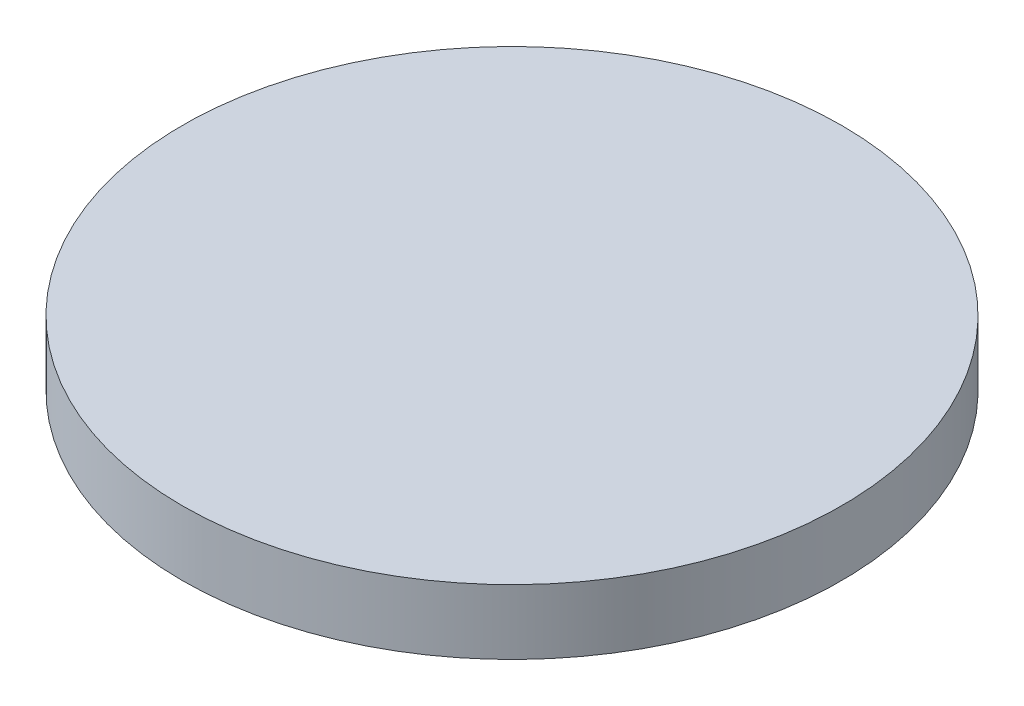
from build123d import *

# Parameters (mm, degrees)
SKETCH1_R           = 15
BOSS_EXTRUDE1_DEPTH = 1.3
BOSS_EXTRUDE2_START = -1.65
SKETCH1_3_R         = 15
SKETCH1_3_R_2       = 10.75
BOSS_EXTRUDE2_DEPTH = 1.65


with BuildPart() as part:
    # Sketch1 → Boss-Extrude1 (new body)
    with BuildSketch(Plane(origin=(0, 0, 0), x_dir=(1, 0, 0), z_dir=(0, 1, 0))):
        Circle(SKETCH1_R)
    extrude(amount=BOSS_EXTRUDE1_DEPTH)

    # Sketch1<3> → Boss-Extrude2 (add)
    with BuildSketch(Plane(origin=(0, 0, 0), x_dir=(1, 0, 0), z_dir=(0, 1, 0)).offset(BOSS_EXTRUDE2_START)):
        Circle(SKETCH1_3_R)
        Circle(SKETCH1_3_R_2, mode=Mode.SUBTRACT)
    extrude(amount=BOSS_EXTRUDE2_DEPTH)


solid = part.part
